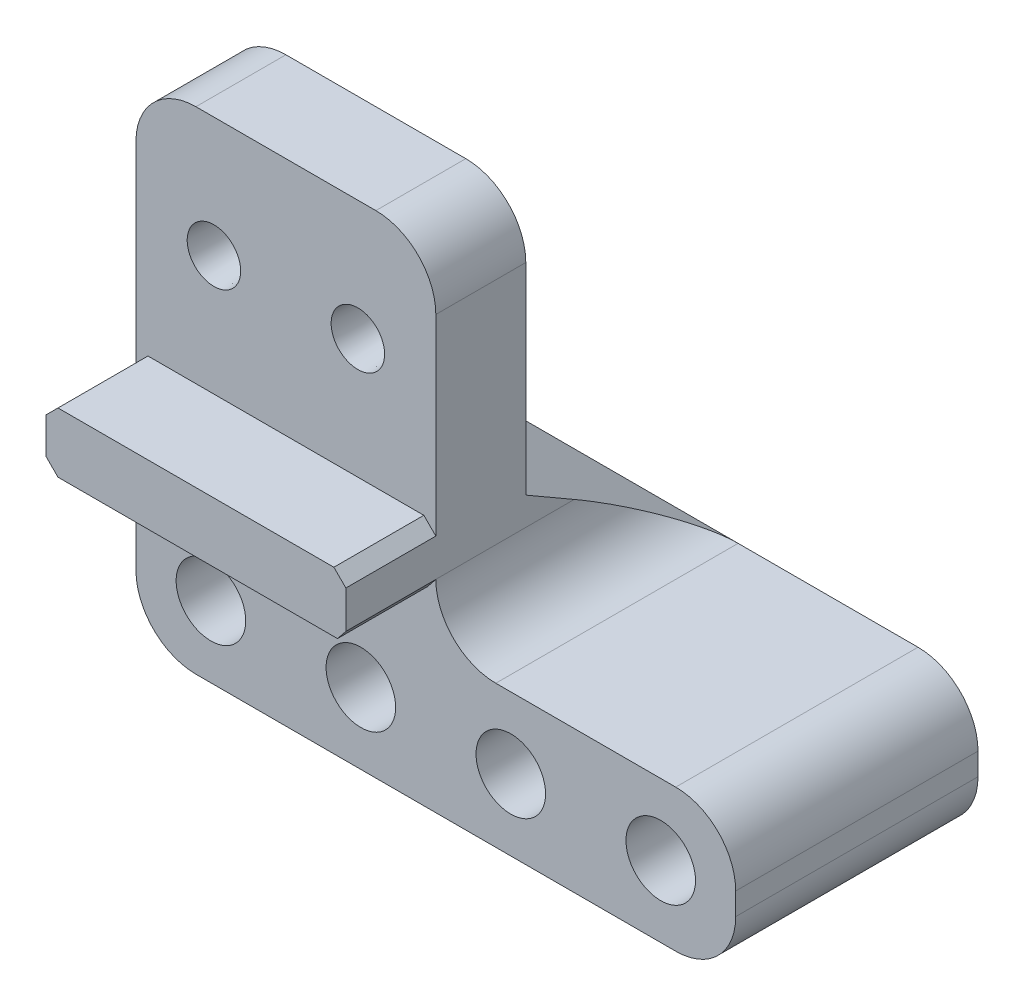
from build123d import *

# Parameters (mm, degrees)
SKETCH4_W                         = 50
SKETCH4_H                         = 40
BOSS_EXTRUDE2_DEPTH               = 15
O_0_316_DIAMETER_HOLE1_AT_2_COUNT = 2
O_0_316_DIAMETER_HOLE1_AT_2_PITCH = 24
SKETCH10_W                        = 50
SKETCH10_H                        = 41.95
BOSS_EXTRUDE3_DEPTH               = 15
SKETCH12_W                        = 50
SKETCH12_H                        = 10
BOSS_EXTRUDE5_DEPTH               = 15
BOSS_EXTRUDE4_REACH               = 94.649
SKETCH11_W                        = 100
SKETCH11_H                        = 23.7
BOSS_EXTRUDE4_DIRECTION_2_DEPTH   = 25.4
O_0_316_DIAMETER_HOLE2_AT_2_COUNT = 2
O_0_316_DIAMETER_HOLE2_AT_2_PITCH = 25
O_0_316_DIAMETER_HOLE2_AT_3_COUNT = 2
O_0_316_DIAMETER_HOLE2_AT_3_PITCH = 50
O_0_316_DIAMETER_HOLE2_AT_4_COUNT = 2
O_0_316_DIAMETER_HOLE2_AT_4_PITCH = 75
CUT_EXTRUDE1_START                = -25.4
SKETCH13_R                        = 5.8
SKETCH13_R_2                      = 4.0132
CUT_EXTRUDE1_DEPTH                = 25.4
CHAMFER3_SIZE2                    = 25.4
CHAMFER3_SIZE                     = 14.664696837
FILLET1_R                         = 10


# Some blends are built 0.0001 mm under size
with BuildPart() as part:
    # Sketch4 → Boss-Extrude2 (new body)
    with BuildSketch(Plane(origin=(0, 0, 5), x_dir=(-1, 0, 0), z_dir=(0, 0, -1))):
        with Locations((6.635038983, -19.8)):
            Rectangle(SKETCH4_W, SKETCH4_H)
    extrude(amount=BOSS_EXTRUDE2_DEPTH)

    # Sketch9 → O (0.316) Diameter Hole1 (revolve, cut)
    with BuildSketch(Plane(origin=(-18.635038983, -19.8, 5), x_dir=(0, -1, 0), z_dir=(1, 0, 0))):
        Polygon((0, 0), (0, 15), (4.0132, 15), (4.0132, 6.350000732), (4.457235307, 0), align=None)
    o_0_316_diameter_hole1 = revolve(axis=Axis((-18.635038983, -19.8, 11.35), (0, 0, -1)), mode=Mode.SUBTRACT)

    # O (0.316) Diameter Hole1 at 2: O (0.316) Diameter Hole1 ×2
    with Locations(*[(i * O_0_316_DIAMETER_HOLE1_AT_2_PITCH, 0, 0) for i in range(1, O_0_316_DIAMETER_HOLE1_AT_2_COUNT)]):
        add(o_0_316_diameter_hole1, mode=Mode.SUBTRACT)

    # Sketch10 → Boss-Extrude3 (add)
    with BuildSketch(Plane(origin=(0, 0, -10), x_dir=(-1, 0, 0), z_dir=(0, 0, -1))):
        with Locations((6.635038983, -60.775)):
            Rectangle(SKETCH10_W, SKETCH10_H)
    extrude(amount=-BOSS_EXTRUDE3_DEPTH)

    # Sketch12 → Boss-Extrude5 (add)
    with BuildSketch(Plane.XY.offset(5)):
        with Locations((-6.635038983, -44.8)):
            Rectangle(SKETCH12_W, SKETCH12_H)
    extrude(amount=BOSS_EXTRUDE5_DEPTH)

    # Boss-Extrude4: up to this face of the body (flat: up to its plane)
    boss_extrude4_end = Plane(part.part.faces().sort_by_distance((-6.635038983, -19.8, 5))[0])
    # Sketch11 → Boss-Extrude4 (add, up to the picked face)
    with BuildSketch(Plane(origin=(0, 0, -10), x_dir=(-1, 0, 0), z_dir=(0, 0, -1)), mode=Mode.PRIVATE) as boss_extrude4_sk1:
        with Locations((-18.364961017, -69.9)):
            Rectangle(SKETCH11_W, SKETCH11_H)
    boss_extrude4_tool1 = split(extrude(boss_extrude4_sk1.sketch, amount=-BOSS_EXTRUDE4_REACH, mode=Mode.PRIVATE), bisect_by=boss_extrude4_end, keep=Keep.BOTH, mode=Mode.PRIVATE)
    add(boss_extrude4_tool1.solids().sort_by(Axis((18.364961, -69.9, -10), (0, 0, 1)))[0])

    # Sketch11 → Boss-Extrude4 direction 2 (add)
    with BuildSketch(Plane(origin=(0, 0, -10), x_dir=(-1, 0, 0), z_dir=(0, 0, -1))):
        with Locations((-18.364961017, -69.9)):
            Rectangle(SKETCH11_W, SKETCH11_H)
    extrude(amount=BOSS_EXTRUDE4_DIRECTION_2_DEPTH)

    # Sketch19 → O (0.316) Diameter Hole2 (revolve, cut)
    with BuildSketch(Plane(origin=(55.864961017, -69.9, -35.4), x_dir=(0, 1, 0), z_dir=(1, 0, 0))):
        Polygon((0, 0), (0, 55.4), (4.0132, 55.4), (4.0132, 6.349926268), (4.4572301, 0), align=None)
    o_0_316_diameter_hole2 = revolve(axis=Axis((55.864961017, -69.9, -41.75), (0, 0, 1)), mode=Mode.SUBTRACT)

    # O (0.316) Diameter Hole2 at 2: O (0.316) Diameter Hole2 ×2
    with Locations(*[(-i * O_0_316_DIAMETER_HOLE2_AT_2_PITCH, 0, 0) for i in range(1, O_0_316_DIAMETER_HOLE2_AT_2_COUNT)]):
        add(o_0_316_diameter_hole2, mode=Mode.SUBTRACT)

    # O (0.316) Diameter Hole2 at 3: O (0.316) Diameter Hole2 ×2
    with Locations(*[(-i * O_0_316_DIAMETER_HOLE2_AT_3_PITCH, 0, 0) for i in range(1, O_0_316_DIAMETER_HOLE2_AT_3_COUNT)]):
        add(o_0_316_diameter_hole2, mode=Mode.SUBTRACT)

    # O (0.316) Diameter Hole2 at 4: O (0.316) Diameter Hole2 ×2
    with Locations(*[(-i * O_0_316_DIAMETER_HOLE2_AT_4_PITCH, 0, 0) for i in range(1, O_0_316_DIAMETER_HOLE2_AT_4_COUNT)]):
        add(o_0_316_diameter_hole2, mode=Mode.SUBTRACT)

    # Sketch13 → Cut-Extrude1 (cut)
    # profile 1 of 4: a face of its own
    with BuildSketch(Plane.XY.offset(5).offset(CUT_EXTRUDE1_START)):
        with Locations((-19.135038983, -69.9)):
            Circle(SKETCH13_R)
        with Locations(Location((-19.135038983, -69.9, 0), (0, 0, 180))):
            Circle(SKETCH13_R_2, mode=Mode.SUBTRACT)
    # profile 2 of 4: a face of its own
    with BuildSketch(Plane.XY.offset(5).offset(CUT_EXTRUDE1_START)):
        with Locations((5.864961017, -69.9)):
            Circle(SKETCH13_R)
        with Locations(Location((5.864961017, -69.9, 0), (0, 0, 180))):
            Circle(SKETCH13_R_2, mode=Mode.SUBTRACT)
    # profile 3 of 4: a face of its own
    with BuildSketch(Plane.XY.offset(5).offset(CUT_EXTRUDE1_START)):
        with Locations((30.864961017, -69.9)):
            Circle(SKETCH13_R)
        with Locations(Location((30.864961017, -69.9, 0), (0, 0, 180))):
            Circle(SKETCH13_R_2, mode=Mode.SUBTRACT)
    # profile 4 of 4: a face of its own
    with BuildSketch(Plane.XY.offset(5).offset(CUT_EXTRUDE1_START)):
        with Locations((55.864961017, -69.9)):
            Circle(SKETCH13_R)
        with Locations(Location((55.864961017, -69.9, 0), (0, 0, 180))):
            Circle(SKETCH13_R_2, mode=Mode.SUBTRACT)
    extrude(amount=CUT_EXTRUDE1_DEPTH, mode=Mode.SUBTRACT)

    # Chamfer3
    chamfer3_edges = [part.edges().sort_by_distance(p)[0] for p in [
        (-6.635038983, -58.05, -10),
    ]]
    chamfer3_side = [part.faces().sort_by_distance(p)[0] for p in [
        (-6.635038983, -57.756706063, -10),
    ]]
    chamfer(chamfer3_edges, length=CHAMFER3_SIZE - 0.0001, length2=CHAMFER3_SIZE2 - 0.0001, reference=chamfer3_side[0])  # a hair under: the kernel refuses the full size

    # Fillet1
    fillet1_edges = [part.edges().sort_by_distance(p)[0] for p in [
        (-31.635038983, -81.75, -15.2),
        (68.364961017, -58.05, -15.2),
        (68.364961017, -81.75, -15.2),
        (18.364961017, 0.2, -2.5),
        (-31.635038983, 0.2, -2.5),
        (18.364961017, -58.05, -15.19995),
    ]]
    fillet(fillet1_edges, radius=FILLET1_R)

    # Chamfer2
    # the kernel refuses this chamfer: 2, 1.724779618 mm, written as the material it takes off along each edge
    with BuildSketch(Plane(origin=(18.519276683, -49.8, 5), x_dir=(-0.058004303634580846, 0.9983163330126716, 0), z_dir=(0, 0, 1))) as chamfer2_piece_1:
        with BuildLine():
            Line((1.793111056, 0), (0.030741404, 1.601811697))
            Line((0.030741404, 1.601811697), (-0.009191249, 1.60413187))
            ThreePointArc((-0.009191249, 1.60413187), (0.006496831, 0.80142144), (-0.039932653, 0.002320172))
            Line((-0.039932653, 0.002320172), (0.004703846, -0.03972246))
            ThreePointArc((0.004703846, -0.03972246), (0.895839611, 0.025445038), (1.790879262, -0.03993769))
            Line((1.790879262, -0.03993769), (1.793111056, 0))
        make_face()
    extrude(amount=19.48277764, mode=Mode.SUBTRACT)
    with BuildSketch(Plane(origin=(-31.635038983, -39.8, 5), x_dir=(0.9996219169112968, 0.0274958766105856, 0), z_dir=(0, 0, 1))) as chamfer2_piece_2:
        with BuildLine():
            Line((2.05734639, 0), (-0.11309431, -2.054235587))
            Line((-0.11309431, -2.054235587), (-0.153079186, -2.053135752))
            ThreePointArc((-0.153079186, -2.053135752), (-0.068258454, -1.026795659), (-0.039984877, 0.001099835))
            Line((-0.039984877, 0.001099835), (0.001099835, 0.039984877))
            ThreePointArc((0.001099835, 0.039984877), (1.028995329, 0.011711299), (2.058446225, 0.039984877))
            Line((2.058446225, 0.039984877), (2.05734639, 0))
        make_face()
    extrude(amount=20.143365976, mode=Mode.SUBTRACT)
    with BuildSketch(Plane(origin=(-31.635038983, -49.8, 5), x_dir=(0.9996219169112968, -0.027495876610585647, 0), z_dir=(0, 0, 1)), Plane(origin=(18.364961017, -39.8, 5), x_dir=(-0.9996219169112968, 0.027495876610585647, 0), z_dir=(0, 0, 1))) as chamfer2_piece_3:
        with BuildLine():
            Line((2.05734639, 0), (-0.11309431, 2.054235587))
            Line((-0.11309431, 2.054235587), (-0.153079186, 2.053135752))
            ThreePointArc((-0.153079186, 2.053135752), (-0.068258454, 1.026795659), (-0.039984877, -0.001099835))
            Line((-0.039984877, -0.001099835), (0.001099835, -0.039984877))
            ThreePointArc((0.001099835, -0.039984877), (1.028995329, -0.011711299), (2.058446225, -0.039984877))
            Line((2.058446225, -0.039984877), (2.05734639, 0))
        make_face()
    extrude(amount=20.143365976, mode=Mode.SUBTRACT)


solid = part.part
